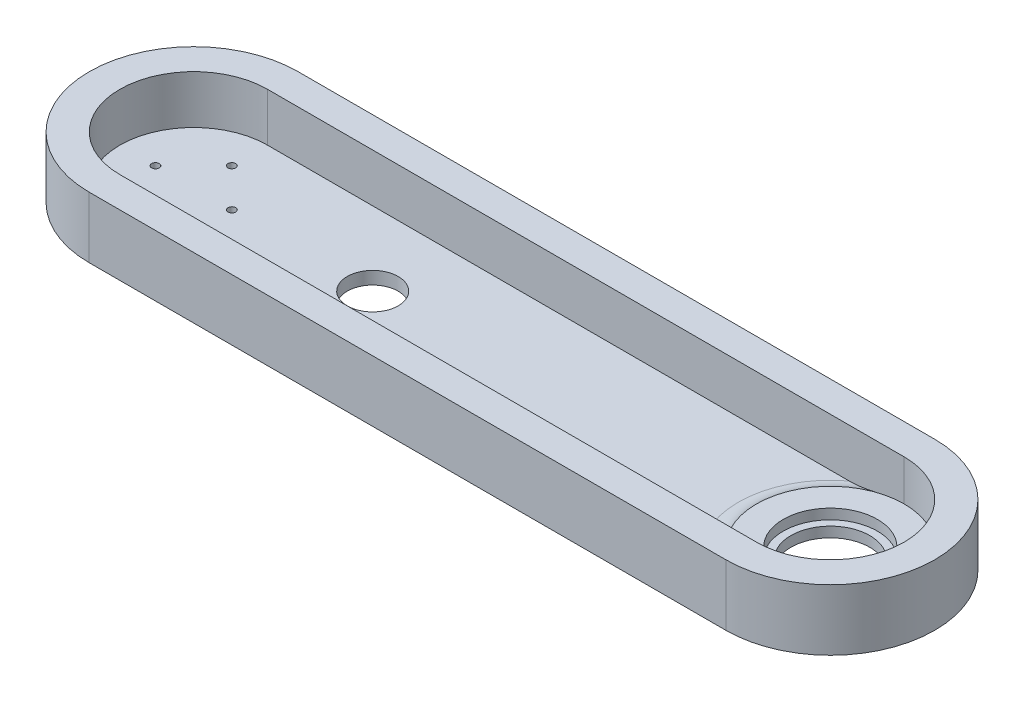
from build123d import *

# Parameters (mm, degrees)
BOSS_EXTRUDE1_DEPTH     = 19
BOSS_EXTRUDE2_START     = -5
BOSS_EXTRUDE2_DEPTH     = 5
CUT_EXTRUDE1_DEPTH      = 295.487690744
CUT_EXTRUDE1_DEPTH_BACK = 295.487690744
SKETCH3_R               = 1.5
SKETCH4_R               = 29
BOSS_EXTRUDE3_DEPTH     = 3
SKETCH5_R               = 18.5
CUT_EXTRUDE2_DEPTH      = 4
CUT_EXTRUDE3_DEPTH      = 295.553899991
CUT_EXTRUDE3_DEPTH_BACK = 295.553899991
SKETCH6_R               = 15.5
FILLET1_R               = 10
CUT_EXTRUDE4_DEPTH      = 295.487690751
CUT_EXTRUDE4_DEPTH_BACK = 295.487690751
SKETCH7_R               = 10


with BuildPart() as part:
    # Sketch1 → Boss-Extrude1 (new body)
    with BuildSketch(Plane(origin=(0, 0, 0), x_dir=(1, 0, 0), z_dir=(0, 1, 0))):
        with BuildLine():
            Line((0, -41), (250, -41))
            ThreePointArc((250, -41), (291, 0), (250, 41))
            Line((250, 41), (0, 41))
            ThreePointArc((0, 41), (-41, 0), (0, -41))
        make_face()
        with BuildLine():
            Line((0, 29), (250, 29))
            ThreePointArc((250, 29), (279, 0), (250, -29))
            Line((250, -29), (0, -29))
            ThreePointArc((0, -29), (-29, 0), (0, 29))
        make_face(mode=Mode.SUBTRACT)
    extrude(amount=BOSS_EXTRUDE1_DEPTH)

    # Sketch1<2> → Boss-Extrude2 (add)
    with BuildSketch(Plane(origin=(0, 0, 0), x_dir=(1, 0, 0), z_dir=(0, 1, 0)).offset(BOSS_EXTRUDE2_START)):
        with BuildLine():
            ThreePointArc((0, 41), (-41, 0), (0, -41))
            Line((0, -41), (250, -41))
            ThreePointArc((250, -41), (291, 0), (250, 41))
            Line((250, 41), (0, 41))
        make_face()
    extrude(amount=BOSS_EXTRUDE2_DEPTH)

    # Sketch3 → Cut-Extrude1 (cut, two sides: drawn at the far end of the back side and taken through both)
    with BuildSketch(Plane(origin=(0, 0, 0), x_dir=(1, 0, 0), z_dir=(0, 1, 0)).offset(-CUT_EXTRUDE1_DEPTH_BACK)):
        with Locations(Location((0, 15, 0), (0, 0, 270))):
            Circle(SKETCH3_R)
        with Locations(Location((15, 0, 0), (0, 0, 270))):
            Circle(SKETCH3_R)
        with Locations(Location((0, -15, 0), (0, 0, 270))):
            Circle(SKETCH3_R)
        with Locations(Location((-15, 0, 0), (0, 0, 270))):
            Circle(SKETCH3_R)
    extrude(amount=CUT_EXTRUDE1_DEPTH + CUT_EXTRUDE1_DEPTH_BACK, mode=Mode.SUBTRACT)

    # Sketch4 → Boss-Extrude3 (add)
    with BuildSketch(Plane(origin=(0, 0, 0), x_dir=(1, 0, 0), z_dir=(0, 1, 0))):
        with Locations((250, 0)):
            Circle(SKETCH4_R)
    extrude(amount=BOSS_EXTRUDE3_DEPTH)

    # Sketch5 → Cut-Extrude2 (cut)
    with BuildSketch(Plane(origin=(0, 3, 0), x_dir=(1, 0, 0), z_dir=(0, 1, 0))):
        with Locations(Location((250, 0, 0), (0, 0, 270))):
            Circle(SKETCH5_R)
    extrude(amount=-CUT_EXTRUDE2_DEPTH, mode=Mode.SUBTRACT)

    # Sketch6 → Cut-Extrude3 (cut, two sides: drawn at the far end of the back side and taken through both)
    with BuildSketch(Plane(origin=(0, -1, 0), x_dir=(1, 0, 0), z_dir=(0, 1, 0)).offset(-CUT_EXTRUDE3_DEPTH_BACK)):
        with Locations(Location((250, 0, 0), (0, 0, 270))):
            Circle(SKETCH6_R)
    extrude(amount=CUT_EXTRUDE3_DEPTH + CUT_EXTRUDE3_DEPTH_BACK, mode=Mode.SUBTRACT)

    # Fillet1
    # the kernel refuses this fillet: 10 mm, written as the material it adds along each edge
    with BuildSketch(Plane(origin=(250, 0, 0), x_dir=(0.5782894613752282, 0, -0.8158316608604672), z_dir=(0.8158316608604672, 0, 0.5782894613752282))) as fillet1_piece_1:
        with BuildLine():
            CenterArc((36.141428429, 10), FILLET1_R, 224.427004001, 45.572995999)
            Line((36.141428429, 0), (36.141428429, -0.2))
            Line((36.141428429, -0.2), (29, -0.2))
            Line((29, -0.2), (28.8, 0))
            ThreePointArc((28.8, 0), (28.8, 1.5), (28.857171431, 2.86))
            Line((28.857171431, 2.86), (29, 3))
        make_face()
    revolve(axis=Axis((250, 0, 0), (0, 1, 0)), revolution_arc=250.660644369)

    # Sketch7 → Cut-Extrude4 (cut, two sides: drawn at the far end of the back side and taken through both)
    with BuildSketch(Plane(origin=(0, 0, 0), x_dir=(1, 0, 0), z_dir=(0, 1, 0)).offset(-CUT_EXTRUDE4_DEPTH_BACK)):
        with Locations(Location((70.3, 0, 0), (0, 0, 270))):
            Circle(SKETCH7_R)
    extrude(amount=CUT_EXTRUDE4_DEPTH + CUT_EXTRUDE4_DEPTH_BACK, mode=Mode.SUBTRACT)


solid = part.part
